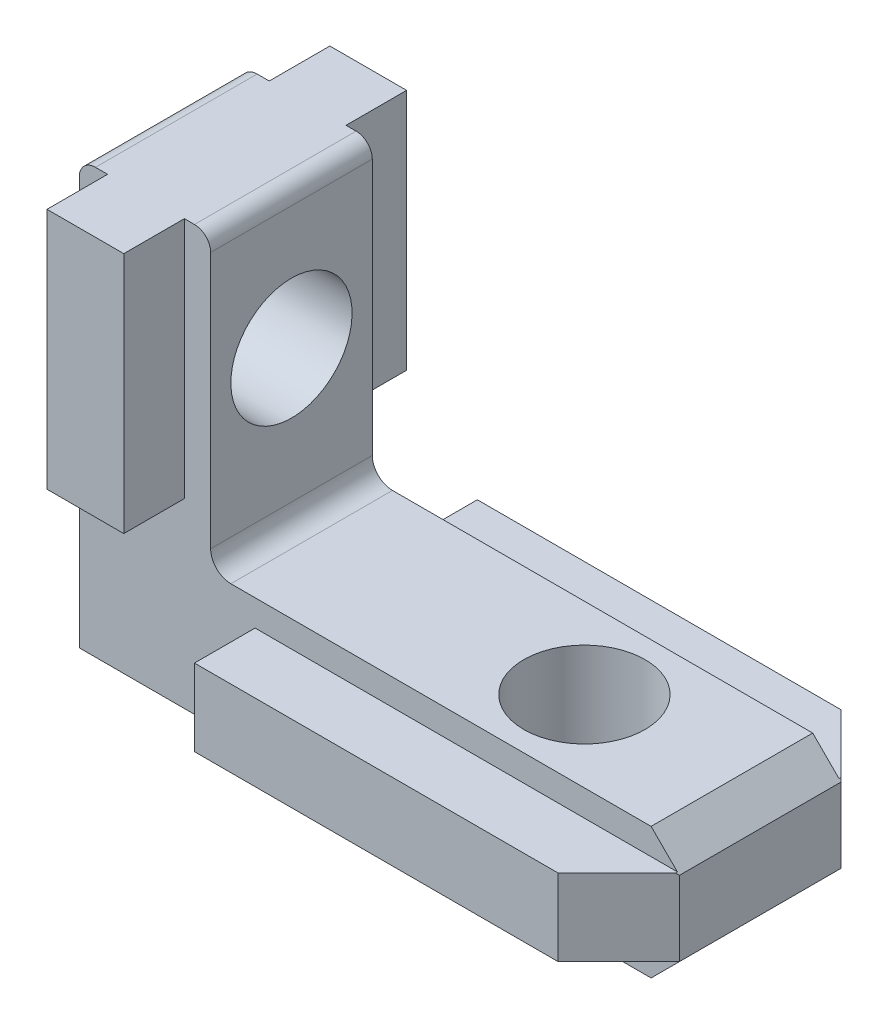
from build123d import *

# Parameters (mm, degrees)
EXTRUDE1_DEPTH           = 4
EXTRUDE1_DEPTH_BACK      = 4
SKETCH2_W                = 3.8
SKETCH2_H                = 12
SKETCH2_W_2              = 21
SKETCH2_H_2              = 3.8
EXTRUDE2_DEPTH           = 3
CHAMFER1_SIZE            = 3
CHAMFER1_OF_MIRROR1_SIZE = 3
CHAMFER2_SIZE            = 1.4
EXTRUDE3_REACH           = 30.24
SKETCH4_R                = 3
FILLET1_R                = 0.8
EXTRUDE4_REACH           = 30.24
SKETCH5_R                = 3
FILLET2_R                = 1


with BuildPart() as part:
    # Sketch1 → Extrude1 (new, two sides: drawn at the far end of the back side and taken through both)
    with BuildSketch(Plane.XY.offset(-EXTRUDE1_DEPTH_BACK)):
        Polygon((0, 0), (0, 14.5), (-6.5, 14.5), (-6.5, -6.5), (23.2, -6.5), (23.2, 0), align=None)
    extrude(amount=EXTRUDE1_DEPTH + EXTRUDE1_DEPTH_BACK)

    # Sketch2 → Extrude2 (add)
    with BuildSketch(Plane.XY.offset(4)):
        with Locations((-3.2, 8.5)):
            Rectangle(SKETCH2_W, SKETCH2_H)
        with Locations((12.7, -3.2)):
            Rectangle(SKETCH2_W_2, SKETCH2_H_2)
    extrude2 = extrude(amount=EXTRUDE2_DEPTH)

    # Chamfer1
    chamfer1_edges = [part.edges().sort_by_distance(p)[0] for p in [
        (23.2, -3.2, 7),
    ]]
    chamfer(chamfer1_edges, length=CHAMFER1_SIZE)

    # Mirror1: Extrude2 across plane
    add(extrude2.mirror(Plane.XY))

    # Chamfer1 of Mirror1
    chamfer1_of_mirror1_edges = [part.edges().sort_by_distance(p)[0] for p in [
        (23.2, -3.2, -7),
    ]]
    chamfer(chamfer1_of_mirror1_edges, length=CHAMFER1_OF_MIRROR1_SIZE)

    # Chamfer2
    # the kernel refuses this chamfer: 1.4 mm, written as the material it takes off along each edge
    with BuildSketch(Plane(origin=(23.2, 0, 7.600356183), x_dir=(0.027495876610586112, -0.9996219169112968, 0), z_dir=(0, 0, -1))) as chamfer2_piece_1:
        Polygon((CHAMFER2_SIZE * 0.999621916911, CHAMFER2_SIZE * 0.0274958766106), (-CHAMFER2_SIZE * 0.0274958766106, CHAMFER2_SIZE * 0.999621916911), (0, 0), align=None)
    extrude(amount=15.200712366, mode=Mode.SUBTRACT)
    with BuildSketch(Plane(origin=(23.2, -6.5, 7.600356183), x_dir=(0.02749587661058614, 0.9996219169112968, 0), z_dir=(0, 0, -1))) as chamfer2_piece_2:
        Polygon((CHAMFER2_SIZE * 0.999621916911, -CHAMFER2_SIZE * 0.0274958766106), (-CHAMFER2_SIZE * 0.0274958766106, -CHAMFER2_SIZE * 0.999621916911), (0, 0), align=None)
    extrude(amount=15.200712366, mode=Mode.SUBTRACT)

    # Sketch4 → Extrude3 (cut, up to next)
    with BuildSketch(Plane(origin=(0, 0, 0), x_dir=(1, 0, 0), z_dir=(0, 1, 0)), mode=Mode.PRIVATE) as extrude3_sk1:
        with Locations(Location((14.5, 0, 0), (0, 0, 270))):
            Circle(SKETCH4_R)
    extrude3_tool1 = extrude(extrude3_sk1.sketch, amount=-EXTRUDE3_REACH, mode=Mode.PRIVATE) & part.part
    add(extrude3_tool1.solids().sort_by_distance((14.5, 0, 0))[0], mode=Mode.SUBTRACT)

    # Fillet1
    fillet1_edges = [part.edges().sort_by_distance(p)[0] for p in [
        (-6.5, 14.5, 0),
        (0, 14.5, 0),
    ]]
    fillet(fillet1_edges, radius=FILLET1_R)

    # Sketch5 → Extrude4 (cut, up to next)
    with BuildSketch(Plane(origin=(0, 0, 0), x_dir=(0, 0, -1), z_dir=(1, 0, 0)), mode=Mode.PRIVATE) as extrude4_sk1:
        with Locations(Location((0, 7.6, 0), (0, 0, 90))):
            Circle(SKETCH5_R)
    extrude4_tool1 = extrude(extrude4_sk1.sketch, amount=-EXTRUDE4_REACH, mode=Mode.PRIVATE) & part.part
    add(extrude4_tool1.solids().sort_by_distance((0, 7.6, 0))[0], mode=Mode.SUBTRACT)

    # Fillet2
    fillet2_edges = [part.edges().sort_by_distance(p)[0] for p in [
        (0, 0, 0),
    ]]
    fillet(fillet2_edges, radius=FILLET2_R)


solid = part.part
